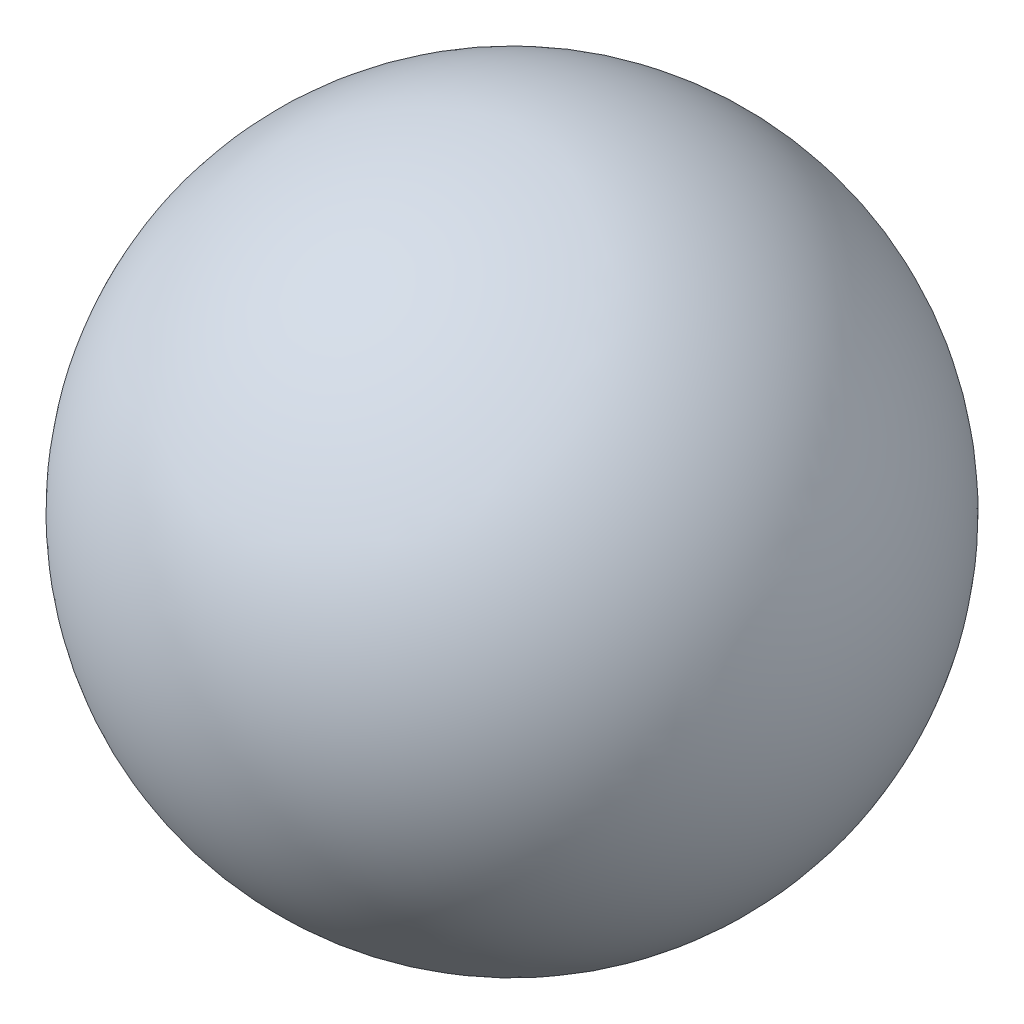
from build123d import *


with BuildPart() as part:
    # Sketch1 → Revolve3 (revolve)
    with BuildSketch(Plane(origin=(0, 0, 0), x_dir=(1, 0, 0), z_dir=(0, 1, 0))):
        with BuildLine():
            Line((-62.983153856, 31.243889395), (-57.983153856, 31.243889395))
            ThreePointArc((-57.983153856, 31.243889395), (-60.483153856, 28.743889395), (-62.983153856, 31.243889395))
        make_face()
    revolve(axis=Axis((-62.983153856, 0, -31.243889395), (1, 0, 0)))


solid = part.part
